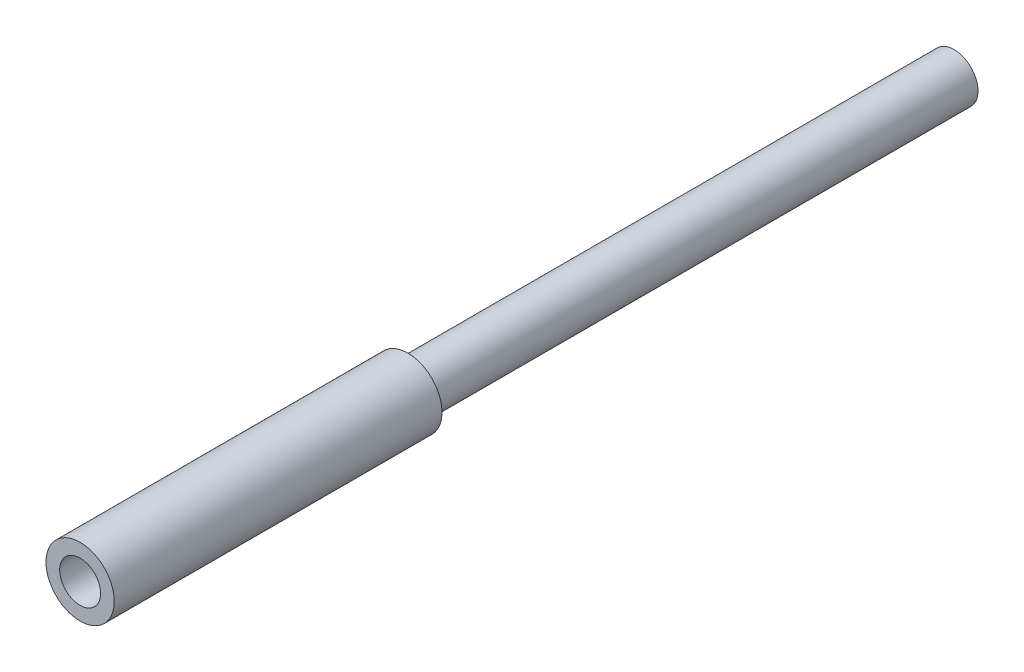
from build123d import *

# Parameters (mm, degrees)
SKETCH1_R           = 7.9375
BOSS_EXTRUDE1_DEPTH = 76.2
SKETCH3_R           = 4.7625
CUT_EXTRUDE2_DEPTH  = 63.5
SKETCH4_R           = 5.5626
BOSS_EXTRUDE2_DEPTH = 127
FILLET1_R           = 0.254


with BuildPart() as part:
    # Sketch1 → Boss-Extrude1 (new body)
    with BuildSketch(Plane.XY):
        Circle(SKETCH1_R)
    extrude(amount=BOSS_EXTRUDE1_DEPTH)

    # Sketch3 → Cut-Extrude2 (cut)
    with BuildSketch(Plane.XY.offset(76.2)):
        Circle(SKETCH3_R)
    extrude(amount=-CUT_EXTRUDE2_DEPTH, mode=Mode.SUBTRACT)

    # Sketch4 → Boss-Extrude2 (add)
    with BuildSketch(Plane(origin=(0, 0, 0), x_dir=(-1, 0, 0), z_dir=(0, 0, -1))):
        Circle(SKETCH4_R)
    extrude(amount=BOSS_EXTRUDE2_DEPTH)

    # Fillet1
    fillet1_edges = [part.edges().sort_by_distance(p)[0] for p in [
        (5.5626, 0, 0),
    ]]
    fillet(fillet1_edges, radius=FILLET1_R)


solid = part.part
